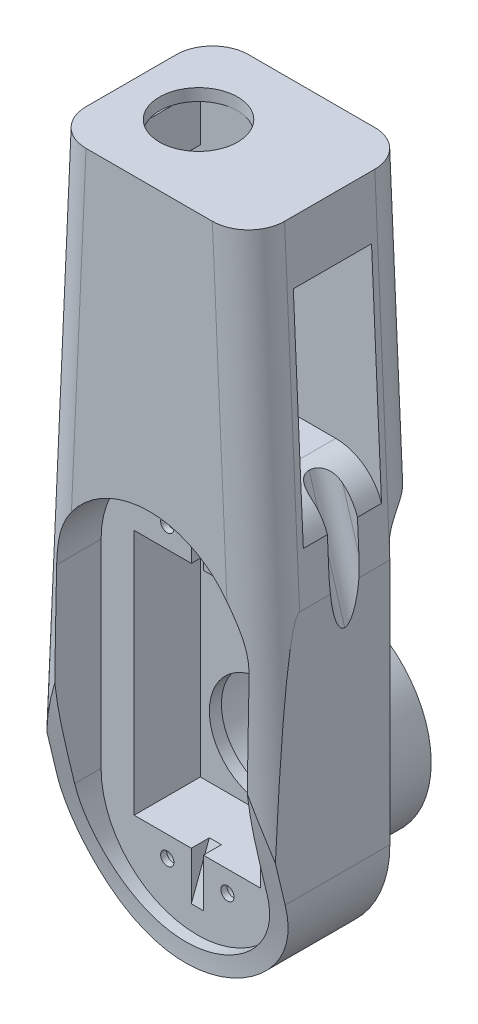
from build123d import *
from OCP.BRepFilletAPI import BRepFilletAPI_MakeChamfer

# Parameters (mm, degrees)
SKETCH1_W               = 38
SKETCH1_H               = 120
SKETCH1_W_2             = 21
SKETCH1_H_2             = 41
BOSS_EXTRUDE1_DEPTH     = 11
SKETCH3_R               = 1.3
CUT_EXTRUDE1_DEPTH      = 8
FILLET3_R               = 19
BOSS_EXTRUDE2_DEPTH     = 8
CUT_EXTRUDE2_DEPTH      = 66.741919656
CUT_EXTRUDE2_DEPTH_BACK = 66.741919656
SKETCH7_W               = 32
SKETCH7_H               = 49
BOSS_EXTRUDE4_DEPTH     = 8
SKETCH8_W               = 38
SKETCH8_H               = 52
BOSS_EXTRUDE5_DEPTH     = 8
BOSS_EXTRUDE6_START     = 2
SKETCH24_R              = 9
BOSS_EXTRUDE6_DEPTH     = 2
FILLET4_R               = 16
SKETCH26_W              = 38
SKETCH26_H              = 27
CUT_EXTRUDE4_DEPTH      = 5
SKETCH27_W              = 13
SKETCH27_H              = 31
CUT_EXTRUDE5_DEPTH      = 74.518705262
SKETCH29_W              = 23
SKETCH29_H              = 13
CUT_EXTRUDE7_DEPTH      = 8
SKETCH28_R              = 6.5
CUT_EXTRUDE8_DEPTH      = 2
SKETCH30_W              = 6
SKETCH30_H              = 5
CUT_EXTRUDE9_DEPTH      = 20
CHAMFER3_SIZE           = 6
CHAMFER3_SIZE_2         = 20
FILLET6_R               = 8
FILLET7_R               = 6
FILLET10_R              = 2.5
SKETCH31_R              = 1.1
CUT_EXTRUDE10_DEPTH     = 8
SKETCH32_R              = 1.1
CUT_EXTRUDE11_DEPTH     = 8
CUT_EXTRUDE13_DEPTH     = 69.483574828
FILLET11_R              = 6
SKETCH35_R              = 16.875
SKETCH35_R_2            = 12.975
BOSS_EXTRUDE7_DEPTH     = 9
CUT_EXTRUDE14_DEPTH     = 1


# Some blends are built 0.0001 mm under size
with BuildPart() as part:
    # Sketch1 → Boss-Extrude1 (new body)
    with BuildSketch(Plane.XY):
        Rectangle(SKETCH1_W, SKETCH1_H)
        with Locations((0, -24.5)):
            Rectangle(SKETCH1_W_2, SKETCH1_H_2, mode=Mode.SUBTRACT)
    extrude(amount=BOSS_EXTRUDE1_DEPTH)

    # Sketch3 → Cut-Extrude1 (cut)
    with BuildSketch(Plane.XY.offset(10)):
        with Locations((-5, -0.5)):
            Circle(SKETCH3_R)
        with Locations((5, -0.5)):
            Circle(SKETCH3_R)
        with Locations((5, -48.5)):
            Circle(SKETCH3_R)
        with Locations((-5, -48.5)):
            Circle(SKETCH3_R)
    extrude(amount=-CUT_EXTRUDE1_DEPTH, mode=Mode.SUBTRACT)

    # Fillet3
    fillet3_edges = [part.edges().sort_by_distance(p)[0] for p in [
        (19, -60, 5.5),
        (-19, -60, 5.5),
    ]]
    fillet(fillet3_edges, radius=FILLET3_R - 0.0001)  # a hair under: the kernel refuses the full size

    # Sketch4 → Boss-Extrude2 (add)
    with BuildSketch(Plane.XY.offset(11)):
        with BuildLine():
            Line((19, -41), (19, 60))
            Line((19, 60), (-19, 60))
            Line((-19, 60), (-19, -41))
            ThreePointArc((-19, -41), (-13.435028843, -54.435028843), (0, -60))
            ThreePointArc((0, -60), (13.435028843, -54.435028843), (19, -41))
        make_face()
        with BuildLine():
            Line((16, -41), (16, 57))
            Line((16, 57), (-16, 57))
            Line((-16, 57), (-16, -41))
            ThreePointArc((-16, -41), (-11.313708499, -52.313708499), (0, -57))
            ThreePointArc((0, -57), (11.313708499, -52.313708499), (16, -41))
        make_face(mode=Mode.SUBTRACT)
    extrude(amount=BOSS_EXTRUDE2_DEPTH)

    # Sketch6 → Cut-Extrude2 (cut, two sides: drawn at the far end of the back side and taken through both)
    with BuildSketch(Plane(origin=(0, 0, 0), x_dir=(0, 0, -1), z_dir=(1, 0, 0)).offset(-CUT_EXTRUDE2_DEPTH_BACK)):
        with BuildLine():
            Line((-19, -60), (-13, -60))
            Line((-13, -60), (-17, -35))
            Line((-17, -35), (-17.230341833, -33.272436255))
            add(Edge.make_bspline(
                [(-19, -20), (-18.961218666, -24.506149192), (-18.200739257, -28.905127919), (-17.230341833, -33.272436255)],
                knots=[0, 0, 0, 0, 0.330908527, 0.330908527, 0.330908527, 0.330908527], degree=3))
            Line((-19, -20), (-19, -60))
        make_face()
        with BuildLine():
            Line((-17, -35), (-13, -60))
            add(Edge.make_bspline(
                [(-17.230341833, -33.272436255), (-15.268214572, -42.103060212), (-12.44785515, -50.804202435), (-13, -60)],
                knots=[0.330908527, 0.330908527, 0.330908527, 0.330908527, 1, 1, 1, 1], degree=3))
            Line((-17.230341833, -33.272436255), (-17, -35))
        make_face()
    extrude(amount=CUT_EXTRUDE2_DEPTH + CUT_EXTRUDE2_DEPTH_BACK, mode=Mode.SUBTRACT)

    # Sketch7 → Boss-Extrude4 (add)
    with BuildSketch(Plane.XY.offset(11)):
        with Locations((0, 32.5)):
            Rectangle(SKETCH7_W, SKETCH7_H)
    extrude(amount=BOSS_EXTRUDE4_DEPTH)

    # Sketch8 → Boss-Extrude5 (add)
    with BuildSketch(Plane(origin=(0, 0, 0), x_dir=(-1, 0, 0), z_dir=(0, 0, -1))):
        with Locations((0, 34)):
            Rectangle(SKETCH8_W, SKETCH8_H)
    extrude(amount=BOSS_EXTRUDE5_DEPTH)

    # Sketch24 → Boss-Extrude6 (add)
    with BuildSketch(Plane(origin=(0, 0, 0), x_dir=(-1, 0, 0), z_dir=(0, 0, -1)).offset(BOSS_EXTRUDE6_START)):
        with BuildLine():
            Line((-19, 8), (-19, -41))
            ThreePointArc((-19, -41), (-13.435028843, -54.435028843), (0, -60))
            ThreePointArc((0, -60), (13.435028843, -54.435028843), (19, -41))
            Line((19, -41), (19, 8))
            Line((19, 8), (-19, 8))
        make_face()
        with Locations((0, -34.75)):
            Circle(SKETCH24_R, mode=Mode.SUBTRACT)
    extrude(amount=-BOSS_EXTRUDE6_DEPTH)

    # Fillet4
    fillet4_edges = [part.edges().sort_by_distance(p)[0] for p in [
        (-16, 8, 15),
        (16, 8, 15),
    ]]
    fillet(fillet4_edges, radius=FILLET4_R - 0.0001)  # a hair under: the kernel refuses the full size

    # Sketch26 → Cut-Extrude4 (cut)
    with BuildSketch(Plane(origin=(0, 60, 0), x_dir=(1, 0, 0), z_dir=(0, 1, 0))):
        with Locations((0, -5.5)):
            Rectangle(SKETCH26_W, SKETCH26_H)
    extrude(amount=-CUT_EXTRUDE4_DEPTH, mode=Mode.SUBTRACT)

    # Sketch27 → Cut-Extrude5 (cut, through all)
    with BuildSketch(Plane(origin=(19, 0, 0), x_dir=(0, 0, -1), z_dir=(1, 0, 0))):
        with Locations((-5.5, 29.5)):
            Rectangle(SKETCH27_W, SKETCH27_H)
    extrude(amount=-CUT_EXTRUDE5_DEPTH, mode=Mode.SUBTRACT)

    # Sketch29 → Cut-Extrude7 (cut)
    with BuildSketch(Plane.XZ.offset(-45)):
        with Locations((0, 5.5)):
            Rectangle(SKETCH29_W, SKETCH29_H)
    extrude(amount=-CUT_EXTRUDE7_DEPTH, mode=Mode.SUBTRACT)

    # Sketch28 → Cut-Extrude8 (cut)
    with BuildSketch(Plane(origin=(0, 55, 0), x_dir=(1, 0, 0), z_dir=(0, 1, 0))):
        with Locations(Location((-5.3, -5.5, 0), (0, 0, 270))):
            Circle(SKETCH28_R)
    extrude(amount=-CUT_EXTRUDE8_DEPTH, mode=Mode.SUBTRACT)

    # Sketch30 → Cut-Extrude9 (cut)
    with BuildSketch(Plane(origin=(0, 14, 0), x_dir=(1, 0, 0), z_dir=(0, 1, 0))):
        with Locations((-16, -5.5)):
            Rectangle(SKETCH30_W, SKETCH30_H)
        with Locations((16, -5.5)):
            Rectangle(SKETCH30_W, SKETCH30_H)
    extrude(amount=-CUT_EXTRUDE9_DEPTH, mode=Mode.SUBTRACT)

    # Chamfer3
    chamfer3_edges_1 = [part.edges().sort_by_distance(p)[0] for p in [
        (13, -6, 5.5),
    ]]
    chamfer3_side_1 = [part.faces().sort_by_distance(p)[0] for p in [
        (13.12, -6, 5.5),
    ]]
    chamfer3_edges_2 = [part.edges().sort_by_distance(p)[0] for p in [
        (-13, -6, 5.5),
    ]]
    chamfer3_side_2 = [part.faces().sort_by_distance(p)[0] for p in [
        (-13.12, -6, 5.5),
    ]]
    chamfer3 = BRepFilletAPI_MakeChamfer(part.part.solid().wrapped)
    for e in chamfer3_edges_1:
        chamfer3.Add(CHAMFER3_SIZE - 0.0001, CHAMFER3_SIZE_2 - 0.0001, e.wrapped, chamfer3_side_1[0].wrapped)
    for e in chamfer3_edges_2:
        chamfer3.Add(CHAMFER3_SIZE - 0.0001, CHAMFER3_SIZE_2 - 0.0001, e.wrapped, chamfer3_side_2[0].wrapped)
    add(Compound.cast(chamfer3.Shape()), mode=Mode.REPLACE)  # a hair under: the kernel refuses the full size

    # Fillet6
    # the kernel refuses this fillet: 8 mm, written as the material it takes off along each edge
    with BuildSketch(Plane(origin=(-19, 14, -1), x_dir=(1, 0, 0), z_dir=(0, 0, 1))) as fillet6_piece_1_section:
        with BuildLine():
            CenterArc((FILLET6_R, -FILLET6_R), FILLET6_R, 90, 90)
            Line((0, -FILLET6_R), (0, 0))
            Line((0, 0), (FILLET6_R, 0))
        make_face()
    fillet6_piece_1 = extrude(amount=24, mode=Mode.PRIVATE)
    fillet6_piece_1 = split(fillet6_piece_1, bisect_by=Plane(origin=(-12.501601439, 13.924002019, 12), z_dir=(0, 0, -1)), keep=Keep.TOP, mode=Mode.PRIVATE)
    add(fillet6_piece_1, mode=Mode.SUBTRACT)
    with BuildSketch(Plane(origin=(19, 14, -1), x_dir=(-1, 0, 0), z_dir=(0, 0, 1))) as fillet6_piece_2_section:
        with BuildLine():
            CenterArc((FILLET6_R, FILLET6_R), FILLET6_R, 180, 90)
            Line((0, FILLET6_R), (0, 0))
            Line((0, 0), (FILLET6_R, 0))
        make_face()
    fillet6_piece_2 = extrude(amount=24, mode=Mode.PRIVATE)
    fillet6_piece_2 = split(fillet6_piece_2, bisect_by=Plane(origin=(12.501601439, 13.924002019, 12), z_dir=(0, 0, -1)), keep=Keep.TOP, mode=Mode.PRIVATE)
    add(fillet6_piece_2, mode=Mode.SUBTRACT)

    # Fillet7
    fillet7_edges = [part.edges().sort_by_distance(p)[0] for p in [
        (0, 8, -2),
    ]]
    fillet(fillet7_edges, radius=FILLET7_R - 0.0001)  # a hair under: the kernel refuses the full size

    # Fillet10
    fillet10_edges = [part.edges().sort_by_distance(p)[0] for p in [
        (16.041314475, 3.862066808, 3),
        (16.041314475, 3.862066808, 8),
        (-16.041314475, 3.862066808, 3),
        (-16.041314475, 3.862066808, 8),
    ]]
    fillet(fillet10_edges, radius=FILLET10_R - 0.0001)  # a hair under: the kernel refuses the full size

    # Sketch31 → Cut-Extrude10 (cut)
    with BuildSketch(Plane.XY.offset(11)):
        with Locations((-5, -0.5)):
            Circle(SKETCH31_R)
        with Locations((5, -0.5)):
            Circle(SKETCH31_R)
        with Locations((5, -48.5)):
            Circle(SKETCH31_R)
        with Locations((-5, -48.5)):
            Circle(SKETCH31_R)
    extrude(amount=-CUT_EXTRUDE10_DEPTH, mode=Mode.SUBTRACT)

    # Sketch32 → Cut-Extrude11 (cut)
    with BuildSketch(Plane.XZ.offset(-45)):
        with Locations(Location((13.8, 5.5, 0), (0, 0, 270))):
            Circle(SKETCH32_R)
        with Locations(Location((-13.8, 5.5, 0), (0, 0, 270))):
            Circle(SKETCH32_R)
    extrude(amount=-CUT_EXTRUDE11_DEPTH, mode=Mode.SUBTRACT)

    # Sketch34 → Cut-Extrude13 (cut, through all)
    with BuildSketch(Plane.XY.offset(19)):
        Polygon((16.5, 55), (19, 0), (19, 55), align=None)
        Polygon((-16.5, 55), (-19, 0), (-19, 55), align=None)
    extrude(amount=-CUT_EXTRUDE13_DEPTH, mode=Mode.SUBTRACT)

    # Fillet11
    # the kernel refuses this fillet: 6 mm, written as the material it takes off along each edge
    with BuildSketch(Plane(origin=(-20.271039429, -27.962867448, -8), x_dir=(0, 0, 1), z_dir=(0.04540766091865005, 0.9989685402102996, 0)), Plane(origin=(20.271039429, -27.962867448, -8), x_dir=(-0.9989685402102996, -0.04540766091865018, 0), z_dir=(-0.04540766091865018, 0.9989685402102996, 0))) as fillet11_piece_1:
        with BuildLine():
            CenterArc((FILLET11_R, FILLET11_R), FILLET11_R, 180, 90)
            Line((0, FILLET11_R), (-FILLET11_R * 0.02, FILLET11_R))
            Line((-FILLET11_R * 0.02, FILLET11_R), (-FILLET11_R * 0.02, -FILLET11_R * 0.02))
            Line((-FILLET11_R * 0.02, -FILLET11_R * 0.02), (FILLET11_R, -FILLET11_R * 0.02))
            Line((FILLET11_R, -FILLET11_R * 0.02), (FILLET11_R, 0))
        make_face()
    extrude(amount=119.048528665, mode=Mode.SUBTRACT)
    with BuildSketch(Plane(origin=(-14.865324207, 90.962867448, 19), x_dir=(0, 0, -1), z_dir=(-0.04540766091865005, -0.9989685402102996, 0)), Plane(origin=(14.865324207, 90.962867448, 19), x_dir=(-0.9989685402102996, -0.04540766091865018, 0), z_dir=(0.04540766091865018, -0.9989685402102996, 0))) as fillet11_piece_2:
        with BuildLine():
            CenterArc((FILLET11_R, FILLET11_R), FILLET11_R, 180, 90)
            Line((0, FILLET11_R), (-FILLET11_R * 0.02, FILLET11_R))
            Line((-FILLET11_R * 0.02, FILLET11_R), (-FILLET11_R * 0.02, -FILLET11_R * 0.02))
            Line((-FILLET11_R * 0.02, -FILLET11_R * 0.02), (FILLET11_R, -FILLET11_R * 0.02))
            Line((FILLET11_R, -FILLET11_R * 0.02), (FILLET11_R, 0))
        make_face()
    extrude(amount=127.056788864, mode=Mode.SUBTRACT)

    # Sketch35 → Boss-Extrude7 (add)
    with BuildSketch(Plane(origin=(0, 0, -2), x_dir=(-1, 0, 0), z_dir=(0, 0, -1))):
        with Locations((0, -34.75)):
            Circle(SKETCH35_R)
        with Locations((0, -34.75)):
            Circle(SKETCH35_R_2, mode=Mode.SUBTRACT)
    extrude(amount=BOSS_EXTRUDE7_DEPTH)

    # Sketch36 → Cut-Extrude14 (cut, symmetric)
    with BuildSketch(Plane(origin=(0, 0, 0), x_dir=(0, 0, -1), z_dir=(1, 0, 0))):
        Polygon((-11, -45), (-11, -53), (-8, -45), align=None)
        Polygon((-11, -4), (-11, 4), (-8, -4), align=None)
    extrude(amount=CUT_EXTRUDE14_DEPTH, both=True, mode=Mode.SUBTRACT)


solid = part.part
